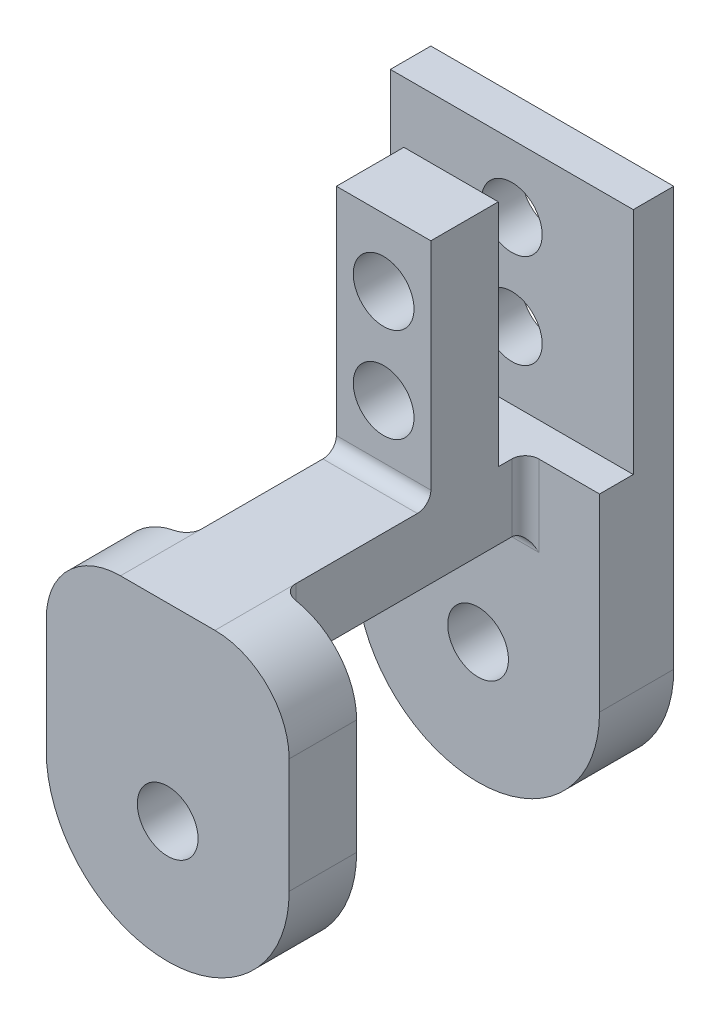
from build123d import *

# Parameters (mm, degrees)
ESQUISSE1_W             = 20
ESQUISSE1_H             = 17
ESQUISSE1_R             = 2.1
BOSS_EXTRU_1_DEPTH      = 5
ESQUISSE2_W             = 18
ESQUISSE2_H             = 3
BOSS_EXTRU_3_DEPTH      = 23
ESQUISSE5_W             = 6.5
ESQUISSE5_H             = 17
ENL_V_MAT_EXTRU_3_DEPTH = 18
ESQUISSE10_W            = 7
ESQUISSE10_H            = 3
BOSS_EXTRU_6_DEPTH      = 10
ESQUISSE11_W            = 5.5
ESQUISSE11_H            = 2.5
ESQUISSE11_W_2          = 7
ESQUISSE11_H_2          = 0.5
BOSS_EXTRU_7_DEPTH      = 17
ESQUISSE12_W            = 18
ESQUISSE12_H            = 2.5
BOSS_EXTRU_8_DEPTH      = 23
CONG_3_R                = 9
ESQUISSE20_R            = 2.25
ENL_V_MAT_EXTRU_7_DEPTH = 18
ESQUISSE22_W            = 7
ESQUISSE22_H            = 5
BOSS_EXTRU_9_DEPTH      = 23
ESQUISSE27_W            = 5.5
ESQUISSE27_H            = 5
ESQUISSE27_W_2          = 7
BOSS_EXTRU_10_DEPTH     = 23
CONG_4_R                = 9
ESQUISSE28_R            = 2.25
ENL_V_MAT_EXTRU_8_DEPTH = 44
CONG_5_R                = 1
CONG_6_R                = 5.5


with BuildPart() as part:
    # Esquisse1 → Boss.-Extru.1 (new body)
    with BuildSketch(Plane.XY):
        with Locations((10, 8.5)):
            Rectangle(ESQUISSE1_W, ESQUISSE1_H)
        with Locations((10, 5)):
            Circle(ESQUISSE1_R, mode=Mode.SUBTRACT)
        with Locations((10, 12)):
            Circle(ESQUISSE1_R, mode=Mode.SUBTRACT)
    extrude(amount=BOSS_EXTRU_1_DEPTH)

    # Esquisse5 → Enlèv. mat.-Extru.3 (cut)
    with BuildSketch(Plane.XY.offset(5)):
        with Locations((16.75, 8.5)):
            Rectangle(ESQUISSE5_W, ESQUISSE5_H)
        with Locations((3.25, 8.5)):
            Rectangle(ESQUISSE5_W, ESQUISSE5_H)
    extrude(amount=-ENL_V_MAT_EXTRU_3_DEPTH, mode=Mode.SUBTRACT)



with BuildPart() as body_2:
    # Esquisse2 → Boss.-Extru.3 (new body)
    with BuildSketch(Plane.XZ):
        with Locations((10, -3.5)):
            Rectangle(ESQUISSE2_W, ESQUISSE2_H)
    extrude(amount=BOSS_EXTRU_3_DEPTH)


with BuildPart() as part_1:
    add(part.part)

    add(body_2.part)  # Boss.-Extru.6 merges body 2
    # Esquisse10 → Boss.-Extru.6 (add)
    with BuildSketch(Plane.XY.offset(5)):
        with Locations((10, -1.5)):
            Rectangle(ESQUISSE10_W, ESQUISSE10_H)
    extrude(amount=-BOSS_EXTRU_6_DEPTH)

    # Esquisse11 → Boss.-Extru.7 (add)
    with BuildSketch(Plane(origin=(0, 0, 0), x_dir=(1, 0, 0), z_dir=(0, 1, 0))):
        with Locations((3.75, 6.25)):
            Rectangle(ESQUISSE11_W, ESQUISSE11_H)
        with Locations((10, 6.25)):
            Rectangle(ESQUISSE11_W_2, ESQUISSE11_H)
        with Locations((16.25, 6.25)):
            Rectangle(ESQUISSE11_W, ESQUISSE11_H)
        with Locations((3.75, 4.75)):
            Rectangle(ESQUISSE11_W, ESQUISSE11_H_2)
        with Locations((10, 4.75)):
            Rectangle(ESQUISSE11_W_2, ESQUISSE11_H_2)
        with Locations((16.25, 4.75)):
            Rectangle(ESQUISSE11_W, ESQUISSE11_H_2)
    extrude(amount=BOSS_EXTRU_7_DEPTH)

    # Esquisse12 → Boss.-Extru.8 (add)
    with BuildSketch(Plane.XZ):
        with Locations((10, -6.25)):
            Rectangle(ESQUISSE12_W, ESQUISSE12_H)
    extrude(amount=BOSS_EXTRU_8_DEPTH)

    # Congé3
    cong_3_edges = [part_1.edges().sort_by_distance(p)[0] for p in [
        (19, -23, -4.75),
        (1, -23, -4.75),
    ]]
    fillet(cong_3_edges, radius=CONG_3_R - 0.0001)  # a hair under: the kernel refuses the full size

    # Esquisse20 → Enlèv. mat.-Extru.7 (cut)
    with BuildSketch(Plane.XY.offset(5)):
        with Locations((10, 5)):
            Circle(ESQUISSE20_R)
        with Locations((10, 12)):
            Circle(ESQUISSE20_R)
    extrude(amount=-ENL_V_MAT_EXTRU_7_DEPTH, mode=Mode.SUBTRACT)

    # Esquisse22 → Boss.-Extru.9 (add)
    with BuildSketch(Plane.XY.offset(-2)):
        with Locations((10, -2.5)):
            Rectangle(ESQUISSE22_W, ESQUISSE22_H)
    extrude(amount=BOSS_EXTRU_9_DEPTH)

    # Esquisse27 → Boss.-Extru.10 (add)
    with BuildSketch(Plane(origin=(0, 0, 0), x_dir=(1, 0, 0), z_dir=(0, 1, 0))):
        with Locations((3.75, -18.5)):
            Rectangle(ESQUISSE27_W, ESQUISSE27_H)
        with Locations((16.25, -18.5)):
            Rectangle(ESQUISSE27_W, ESQUISSE27_H)
        with Locations((10, -18.5)):
            Rectangle(ESQUISSE27_W_2, ESQUISSE27_H)
    extrude(amount=-BOSS_EXTRU_10_DEPTH)

    # Congé4
    cong_4_edges = [part_1.edges().sort_by_distance(p)[0] for p in [
        (1, -23, 18.5),
        (19, -23, 18.5),
    ]]
    fillet(cong_4_edges, radius=CONG_4_R - 0.0001)  # a hair under: the kernel refuses the full size

    # Esquisse28 → Enlèv. mat.-Extru.8 (cut)
    with BuildSketch(Plane.XY.offset(21)):
        with Locations((10, -14)):
            Circle(ESQUISSE28_R)
    extrude(amount=-ENL_V_MAT_EXTRU_8_DEPTH, mode=Mode.SUBTRACT)

    # Congé5
    cong_5_edges = [part_1.edges().sort_by_distance(p)[0] for p in [
        (10, 0, 5),
        (10, -5, -2),
        (10, -5, 16),
        (6.5, -2.5, 16),
        (13.5, -2.5, 16),
        (6.5, -2.5, -2),
        (13.5, -2.5, -2),
    ]]
    fillet(cong_5_edges, radius=CONG_5_R)

    # Congé6
    cong_6_edges = [part_1.edges().sort_by_distance(p)[0] for p in [
        (1, 0, 18.5),
        (19, 0, 18.5),
    ]]
    fillet(cong_6_edges, radius=CONG_6_R - 0.0001)  # a hair under: the kernel refuses the full size


solid = part_1.part
